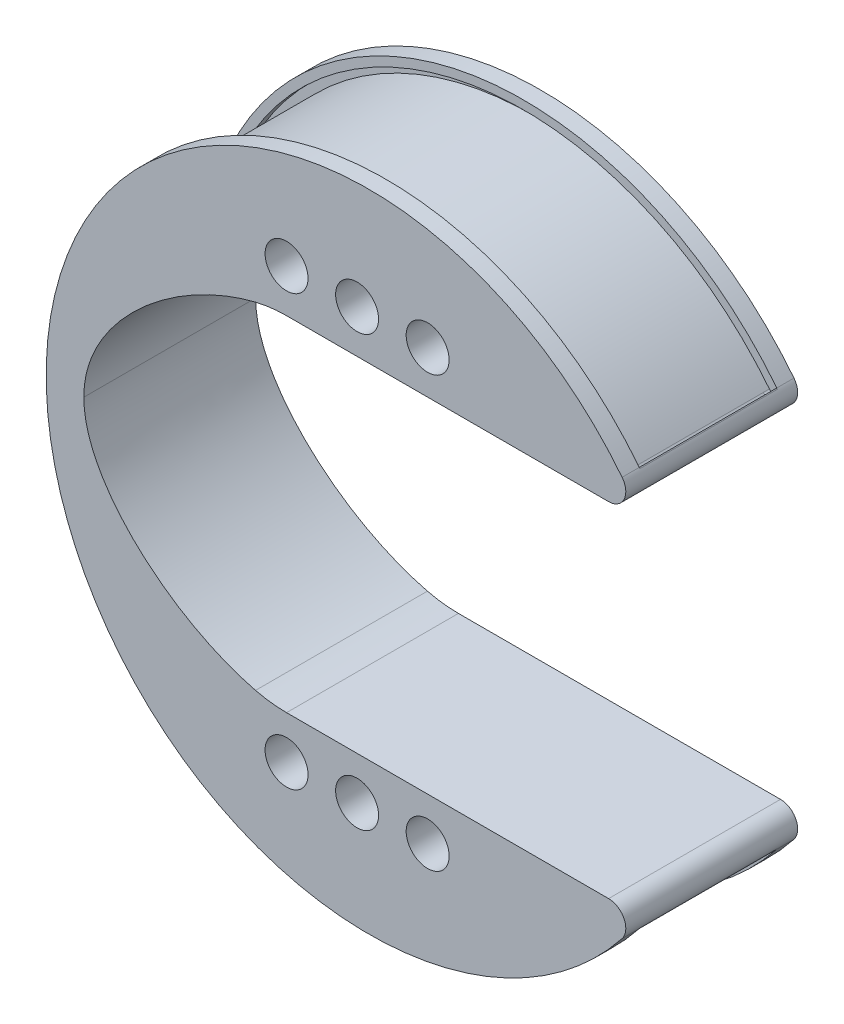
from build123d import *

# Parameters (mm, degrees)
BOSS_EXTRUDE1_OUTLINE_R = 2.5
BOSS_EXTRUDE1_DEPTH     = 20
SKETCH3_R               = 2.5
BOSS_EXTRUDE2_DEPTH     = 15
BOSS_EXTRUDE5_START     = -20
BOSS_EXTRUDE5_DEPTH     = 20
FILLET1_R               = 2
CUT_EXTRUDE1_DEPTH      = 8
CUT_EXTRUDE2_DEPTH      = 9


# Read off the part's stored shape, not the designer's step: Boss-Extrude1
with BuildPart() as part:
    # Boss-Extrude1 outline → Boss-Extrude1 (new body)
    with BuildSketch(Plane.XY):
        with BuildLine():
            add(Edge.make_bspline(
                [(0, 0), (-0.093345976, -8.132199046), (9.987102308, -17.085085201), (19.974576426, -19.559728919)],
                knots=[0, 0, 0, 0, 1, 1, 1, 1], degree=3))
            add(Edge.make_bspline(
                [(0, 0), (-0.093345976, 8.132199046), (9.987102308, 17.085085201), (19.974576426, 19.559728919)],
                knots=[0, 0, 0, 0, 1, 1, 1, 1], degree=3))
            ThreePointArc((19.974576426, 19.559728919), (21.76495963, 19.889525409), (23.58210935, 20))
            Line((23.58210935, 20), (40, 20))
            ThreePointArc((40, 20), (45, 25), (40, 30))
            Line((40, 30), (23.58210935, 30))
            ThreePointArc((23.58210935, 30), (20.553526483, 29.815875681), (17.569554476, 29.266214865))
            ThreePointArc((17.569554476, 29.266214865), (-4.387795245, 0), (17.569554476, -29.266214865))
            ThreePointArc((17.569554476, -29.266214865), (20.553526483, -29.815875681), (23.58210935, -30))
            Line((23.58210935, -30), (40, -30))
            ThreePointArc((40, -30), (45, -25), (40, -20))
            Line((40, -20), (23.58210935, -20))
            ThreePointArc((23.58210935, -20), (21.76495963, -19.889525409), (19.974576426, -19.559728919))
        make_face()
        with Locations((23.58210935, -25)):
            Circle(BOSS_EXTRUDE1_OUTLINE_R, mode=Mode.SUBTRACT)
        with Locations((31.791054675, -25)):
            Circle(BOSS_EXTRUDE1_OUTLINE_R, mode=Mode.SUBTRACT)
        with Locations((40, -25)):
            Circle(BOSS_EXTRUDE1_OUTLINE_R, mode=Mode.SUBTRACT)
        with Locations((23.58210935, 25)):
            Circle(BOSS_EXTRUDE1_OUTLINE_R, mode=Mode.SUBTRACT)
        with Locations((31.791054675, 25)):
            Circle(BOSS_EXTRUDE1_OUTLINE_R, mode=Mode.SUBTRACT)
        with Locations((40, 25)):
            Circle(BOSS_EXTRUDE1_OUTLINE_R, mode=Mode.SUBTRACT)
    extrude(amount=BOSS_EXTRUDE1_DEPTH)

    # Sketch3 → Boss-Extrude2 (add)
    with BuildSketch(Plane.XY):
        with Locations((23.58210935, 25)):
            Circle(SKETCH3_R)
        with Locations((31.791054675, 25)):
            Circle(SKETCH3_R)
        with Locations((40, 25)):
            Circle(SKETCH3_R)
        with Locations((23.58210935, -25)):
            Circle(SKETCH3_R)
        with Locations((31.791054675, -25)):
            Circle(SKETCH3_R)
        with Locations((40, -25)):
            Circle(SKETCH3_R)
    extrude(amount=BOSS_EXTRUDE2_DEPTH)

    # Sketch6 → Boss-Extrude5 (add)
    with BuildSketch(Plane.XY.offset(20).offset(BOSS_EXTRUDE5_START)):
        with BuildLine():
            Line((40, 20), (64.912199257, 20))
            ThreePointArc((64.912199257, 20), (22.740082707, 36.064141627), (-4.387795245, 1.8e-07))
            ThreePointArc((-4.387795245, 1.8e-07), (1.711810468, 18.293691193), (17.569554476, 29.266214865))
            ThreePointArc((17.569554476, 29.266214865), (20.553526483, 29.815875681), (23.58210935, 30))
            Line((23.58210935, 30), (40, 30))
            ThreePointArc((40, 30), (45, 25), (40, 20))
        make_face()
        with BuildLine():
            ThreePointArc((17.569554476, -29.266214865), (1.71181036, -18.293691049), (-4.387795245, 1.8e-07))
            ThreePointArc((-4.387795245, 1.8e-07), (22.740082534, -36.064141577), (64.912199257, -20))
            Line((64.912199257, -20), (40, -20))
            ThreePointArc((40, -20), (45, -25), (40, -30))
            Line((40, -30), (23.58210935, -30))
            ThreePointArc((23.58210935, -30), (20.553526483, -29.815875681), (17.569554476, -29.266214865))
        make_face()
    extrude(amount=BOSS_EXTRUDE5_DEPTH)

    # Fillet1
    fillet1_edges = [part.edges().sort_by_distance(p)[0] for p in [
        (64.912199257, -20, 10),
        (64.912199257, 20, 10),
    ]]
    fillet(fillet1_edges, radius=FILLET1_R)

    # Sketch7 → Cut-Extrude1 (cut, symmetric)
    with BuildSketch(Plane.XY.offset(10)):
        with BuildLine():
            ThreePointArc((61.055324679, 22), (-2.387795245, 0), (61.055324679, -22))
            ThreePointArc((61.055324679, -22), (62.459734828, -21.833770838), (62.62596399, -23.238180987))
            ThreePointArc((62.62596399, -23.238180987), (-4.387795245, 0), (62.62596399, 23.238180987))
            ThreePointArc((62.62596399, 23.238180987), (62.459734828, 21.833770838), (61.055324679, 22))
        make_face()
    extrude(amount=CUT_EXTRUDE1_DEPTH, both=True, mode=Mode.SUBTRACT)

    # Sketch8 → Cut-Extrude2 (cut, symmetric)
    with BuildSketch(Plane.XY.offset(10)):
        with BuildLine():
            ThreePointArc((61.055324679, 22), (-2.387795245, 0), (61.055324679, -22))
            ThreePointArc((61.055324679, -22), (61.757529753, -21.916885419), (61.840644334, -22.619090493))
            ThreePointArc((61.840644334, -22.619090493), (-3.387795245, 0), (61.840644334, 22.619090493))
            ThreePointArc((61.840644334, 22.619090493), (61.757529753, 21.916885419), (61.055324679, 22))
        make_face()
    extrude(amount=CUT_EXTRUDE2_DEPTH, both=True, mode=Mode.SUBTRACT)


solid = part.part
